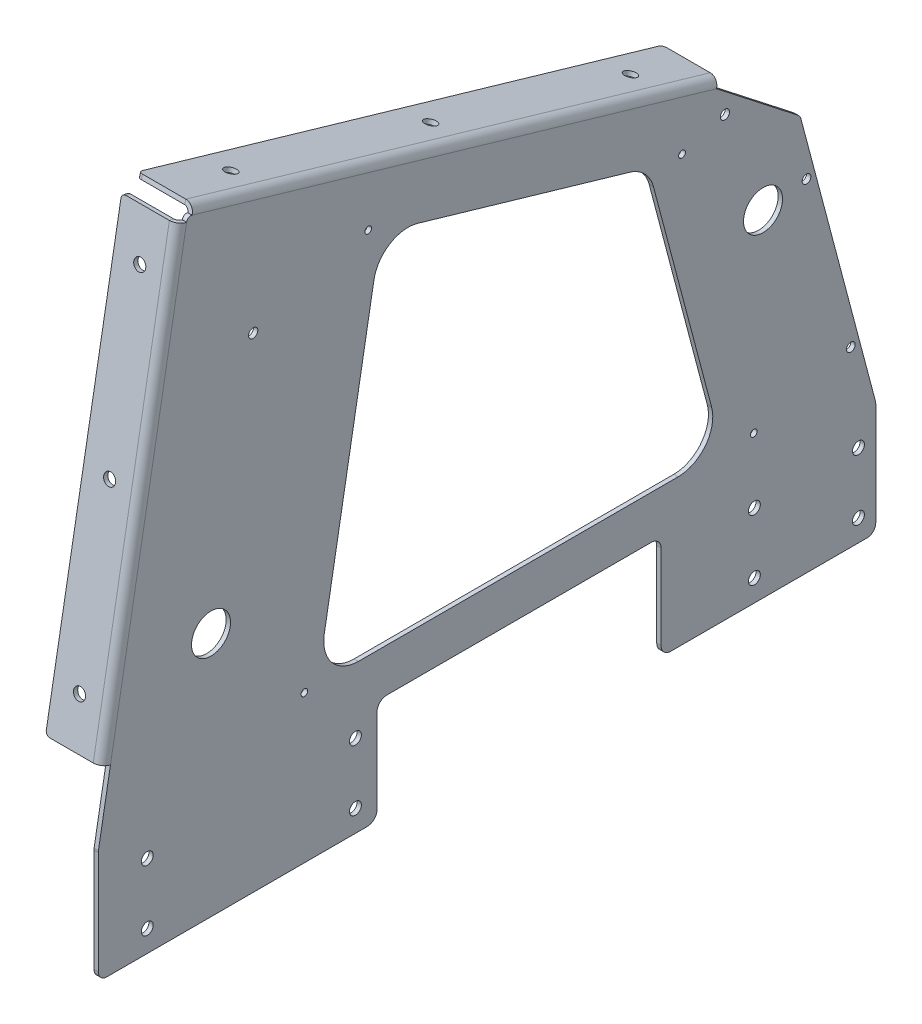
from build123d import *

# Parameters (mm, degrees)
SKETCH1_R                            = 14.2875
SKETCH1_R_2                          = 3.37312
BOSS_EXTRUDE1_DEPTH                  = 3.175
EDGE_FLANGE1_DEPTH                   = 399.923481586
EDGE_FLANGE2_DEPTH                   = 371.853711622
F_11_32_0_34375_DIAMETER_HOLE4_D     = 8.73125
F_1_4_0_25_DIAMETER_HOLE1_D          = 6.35
F_17_64_0_26563_DIAMETER_HOLE2_D     = 6.747002
F_11_32_0_34375_DIAMETER_HOLE2_D     = 8.73125
F_11_32_0_34375_DIAMETER_HOLE3_D     = 8.73125
F_11_32_0_34375_DIAMETER_HOLE3_DEPTH = 3.175
F_10_0_1935_DIAMETER_HOLE1_D         = 4.9149
CUT_EXTRUDE1_DEPTH                   = 50.8
FILLET1_R                            = 3.175


# Sheet-metal steps are written as plain solids
with BuildPart() as part:
    # Sketch1 → Boss-Extrude1 (new body)
    with BuildSketch(Plane(origin=(0, 0, 0), x_dir=(0, 0, -1), z_dir=(1, 0, 0))):
        with BuildLine():
            Line((397.810445414, 0), (254.102325414, 0))
            ThreePointArc((254.102325414, 0), (249.050931346, 2.092355932), (246.958575414, 7.14375))
            Line((246.958575414, 7.14375), (246.958575414, 69.05625))
            ThreePointArc((246.958575414, 69.05625), (244.866219482, 74.107644068), (239.814825414, 76.2))
            Line((239.814825414, 76.2), (46.139825414, 76.2))
            ThreePointArc((46.139825414, 76.2), (41.088431346, 74.107644068), (38.996075414, 69.05625))
            Line((38.996075414, 69.05625), (38.996075414, 7.14375))
            ThreePointArc((38.996075414, 7.14375), (36.903719482, 2.092355932), (31.852325414, 0))
            Line((31.852325414, 0), (-158.75, 0))
            ThreePointArc((-158.75, 0), (-163.240128061, 1.859871939), (-165.1, 6.35))
            Line((-165.1, 6.35), (-165.1, 81.994446987))
            ThreePointArc((-165.1, 81.994446987), (-165.075836333, 82.547885953), (-165.003529232, 83.097112915))
            Line((-165.003529232, 83.097112915), (-100.43180985, 449.301531106))
            ThreePointArc((-100.43180985, 449.301531106), (-98.981933252, 451.446245541), (-96.4172045, 451.798536022))
            Line((-96.4172045, 451.798536022), (287.551897257, 339.965982534))
            Line((287.551897257, 339.965982534), (347.134178996, 293.415202216))
            ThreePointArc((347.134178996, 293.415202216), (348.525632464, 291.907463008), (349.363704269, 290.034749489))
            Line((349.363704269, 290.034749489), (403.949421055, 83.617862545))
            ThreePointArc((403.949421055, 83.617862545), (404.107468334, 82.812983692), (404.160445414, 81.994446987))
            Line((404.160445414, 81.994446987), (404.160445414, 6.35))
            ThreePointArc((404.160445414, 6.35), (402.300573474, 1.859871939), (397.810445414, 0))
        make_face()
        with Locations((-82.55, 179.578)):
            Circle(SKETCH1_R, mode=Mode.SUBTRACT)
        with Locations((-51.675354011, 354.676818486)):
            Circle(SKETCH1_R_2, mode=Mode.SUBTRACT)
        with Locations((321.610445414, 245.95582)):
            Circle(SKETCH1_R, mode=Mode.SUBTRACT)
        with BuildLine():
            Line((25.362018074, 107.95), (259.432488996, 107.95))
            ThreePointArc((259.432488996, 107.95), (279.55833085, 117.854500987), (283.988391562, 139.843662232))
            Line((283.988391562, 139.843662232), (241.393515847, 300.916964234))
            ThreePointArc((241.393515847, 300.916964234), (235.020226293, 312.158932355), (223.940339151, 318.810005043))
            Line((223.940339151, 318.810005043), (68.8320461, 363.985922583))
            ThreePointArc((68.8320461, 363.985922583), (48.314216085, 361.16759873), (36.715203303, 344.009883255))
            Line((36.715203303, 344.009883255), (0.347901148, 137.760663713))
            ThreePointArc((0.347901148, 137.760663713), (5.904489219, 117.023194714), (25.362018074, 107.95))
        make_face(mode=Mode.SUBTRACT)
    extrude(amount=-BOSS_EXTRUDE1_DEPTH)

    # Edge-Flange1 section (across the edge) → Edge-Flange1 (add)
    with BuildSketch(Plane(origin=(-3.175, 454.846873902, 95.529363767), x_dir=(-3.4914813388431334e-15, -0.9601064189437506, 0.2796348767643397), z_dir=(0, -0.2796348767643397, -0.9601064189437506))):
        with BuildLine():
            Line((-3.175, 3.175), (-3.175, 38.1))
            Line((-3.175, 38.1), (0, 38.1))
            Line((0, 38.1), (0, 3.175))
            ThreePointArc((0, 3.175), (0.92993597, 0.92993597), (3.175, 0))
            Line((3.175, 0), (3.175, -3.175))
            ThreePointArc((3.175, -3.175), (-1.315128061, -1.315128061), (-3.175, 3.175))
        make_face()
    extrude(amount=EDGE_FLANGE1_DEPTH)

    # Edge-Flange2 section (across the edge) → Edge-Flange2 (add)
    with BuildSketch(Plane(origin=(-3.175, 83.648445879, 168.130293847), x_dir=(-3.4914813388431334e-15, -0.17364817766692356, -0.9848077530122092), z_dir=(0, 0.9848077530122092, -0.17364817766692356))):
        with BuildLine():
            Line((-3.175, 3.175), (-3.175, 38.1))
            Line((-3.175, 38.1), (0, 38.1))
            Line((0, 38.1), (0, 3.175))
            ThreePointArc((0, 3.175), (0.92993597, 0.92993597), (3.175, 0))
            Line((3.175, 0), (3.175, -3.175))
            ThreePointArc((3.175, -3.175), (-1.315128061, -1.315128061), (-3.175, 3.175))
        make_face()
    extrude(amount=EDGE_FLANGE2_DEPTH)

    # 11/32 (0.34375) Diameter Hole4 (through all)
    with Locations(Plane(origin=(0, 0, 0), x_dir=(0, 0, -1), z_dir=(1, 0, 0))):
        with Locations((391.478225414, 60.325), (315.278225414, 60.325), (315.278225414, 15.875), (391.478225414, 15.875), (23.178225414, 60.325), (23.178225414, 15.875), (-129.221774586, 15.875), (-129.221774586, 60.325)):
            Hole(F_11_32_0_34375_DIAMETER_HOLE4_D / 2)

    # 1/4 (0.25) Diameter Hole1 (through all)
    with Locations(Plane(origin=(0, 0, 0), x_dir=(0, 0, -1), z_dir=(1, 0, 0))):
        with Locations((353.440683712, 249.779512828), (385.908994874, 127)):
            Hole(F_1_4_0_25_DIAMETER_HOLE1_D / 2)

    # 17/64 (0.26563) Diameter Hole2 (through all)
    with Locations(Plane.ZY.offset(3.175)):
        with Locations((-293.708669101, 320.53990281)):
            Hole(F_17_64_0_26563_DIAMETER_HOLE2_D / 2)

    # 11/32 (0.34375) Diameter Hole2 (through all)
    with Locations(Plane(origin=(0, 396.680507326, -115.53480176), x_dir=(1, 0, 0), z_dir=(3.001434441127967e-15, 0.9601064189437506, -0.27963487676433957))):
        with Locations((-22.225, 136.69059512), (-22.225, -15.70940488), (-22.225, -168.10940488)):
            Hole(F_11_32_0_34375_DIAMETER_HOLE2_D / 2)

    # 11/32 (0.34375) Diameter Hole3
    with Locations(Plane(origin=(0, 31.825615837, 180.492036493), x_dir=(1, 0, 0), z_dir=(3.6503775023836e-15, 0.17364817766692356, 0.9848077530122092))):
        with Locations((-22.225, 391.508974703), (-22.225, 264.508974703), (-22.225, 137.508974703)):
            Hole(F_11_32_0_34375_DIAMETER_HOLE3_D / 2, depth=F_11_32_0_34375_DIAMETER_HOLE3_DEPTH)

    # #10 (0.1935) Diameter Hole1 (through all)
    with Locations(Plane(origin=(0, 0, 0), x_dir=(0, 0, -1), z_dir=(1, 0, 0))):
        with Locations((32.555298074, 377.825), (-14.185781926, 107.95), (314.845818074, 107.95), (262.310998074, 311.15)):
            Hole(F_10_0_1935_DIAMETER_HOLE1_D / 2)

    # Sketch31 → Cut-Extrude1 (cut)
    with BuildSketch(Plane(origin=(0, 52.374163006, -9.23497803), x_dir=(1, 0, 0), z_dir=(0, -0.9848077530122092, 0.17364817766692356))):
        with BuildLine():
            Line((-3.175, 176.926417089), (0, 176.926417089))
            ThreePointArc((0, 176.926417089), (-1.859871939, 181.416545149), (-6.35, 183.276417089))
            Line((-6.35, 183.276417089), (-41.275, 183.276417089))
            Line((-41.275, 183.276417089), (-41.275, 180.101417089))
            Line((-41.275, 180.101417089), (-6.35, 180.101417089))
            ThreePointArc((-6.35, 180.101417089), (-4.10493597, 179.171481119), (-3.175, 176.926417089))
        make_face()
    extrude(amount=-CUT_EXTRUDE1_DEPTH, mode=Mode.SUBTRACT)

    # Fillet1
    fillet1_edges = [part.edges().sort_by_distance(p)[0] for p in [
        (-41.275, 450.128530552, 105.121956774),
        (-41.275, 133.952346214, 160.87234873),
        (-41.275, 456.371042842, 95.0854434),
        (-41.275, 344.538489354, -288.883658358),
    ]]
    fillet(fillet1_edges, radius=FILLET1_R)


solid = part.part
